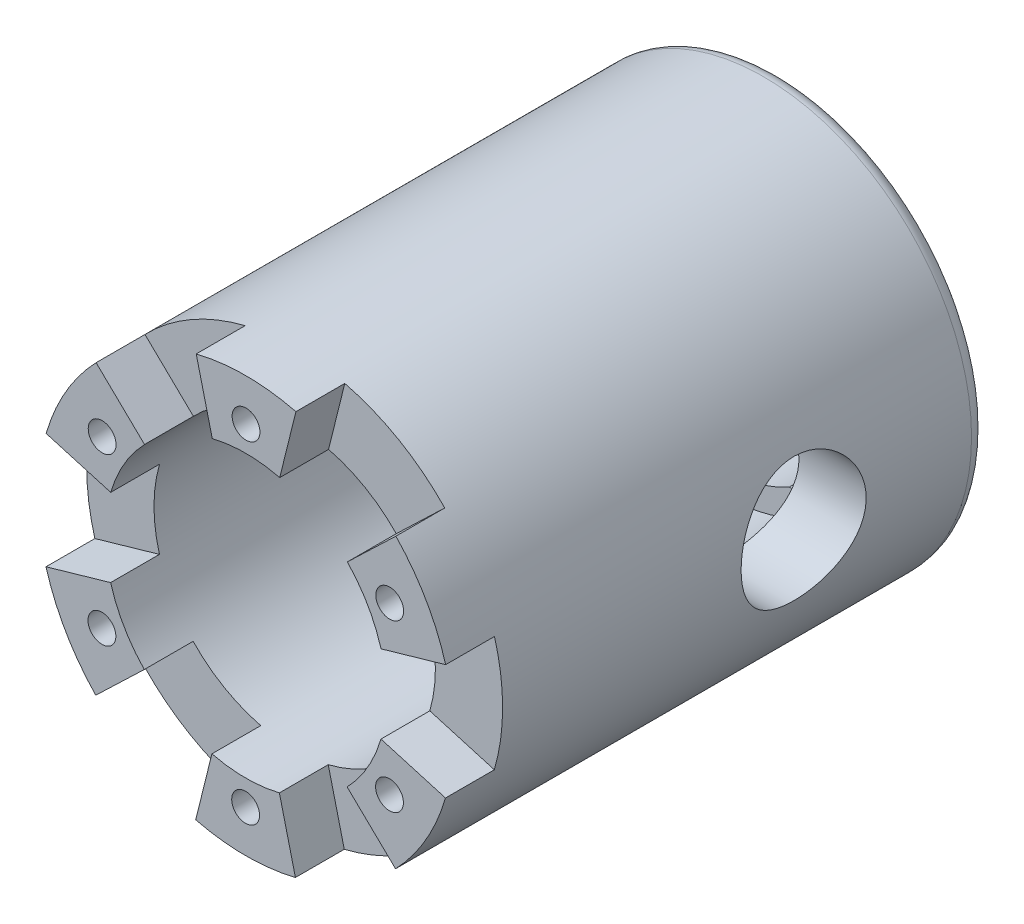
from build123d import *

# Parameters (mm, degrees)
SKETCH1_R                                      = 16.891
BOSS_EXTRUDE1_DEPTH                            = 43.3324
SKETCH9_R                                      = 9.525
CUT_EXTRUDE6_DEPTH                             = 50.480386536
SKETCH10_R                                     = 11.43
BOSS_EXTRUDE2_DEPTH                            = 19.05
CUT_EXTRUDE7_START                             = -39.36365
SKETCH11_R                                     = 9.525
CUT_EXTRUDE7_DEPTH                             = 39.36365
CUT_EXTRUDE8_START                             = -3.96875
CUT_EXTRUDE8_DEPTH                             = 3.96875
CSK_FOR_2_FLAT_HEAD_MACHINE_SCREW1_D           = 2.2606
CSK_FOR_2_FLAT_HEAD_MACHINE_SCREW1_CSINK_D     = 4.3688
CSK_FOR_2_FLAT_HEAD_MACHINE_SCREW1_CSINK_ANGLE = 82
CIRPATTERN1_COUNT                              = 6
F_1_2_0_4_DIAMETER_HOLE1_D                     = 10.16
F_1_2_0_4_DIAMETER_HOLE1_DEPTH                 = 12.7
F_1_2_0_4_DIAMETER_HOLE1_TIP                   = 3.052371945
FILLET1_R                                      = 1.27
SKETCH16_W                                     = 16.51
SKETCH16_H                                     = 16.51
CUT_EXTRUDE9_DEPTH                             = 12.7


with BuildPart() as part:
    # Sketch1 → Boss-Extrude1 (new body)
    with BuildSketch(Plane.XY):
        Circle(SKETCH1_R)
    extrude(amount=BOSS_EXTRUDE1_DEPTH)

    # Sketch9 → Cut-Extrude6 (cut, through all)
    with BuildSketch(Plane(origin=(0, 0, 0), x_dir=(-1, 0, 0), z_dir=(0, 0, -1))):
        Circle(SKETCH9_R)
        with BuildLine():
            ThreePointArc((-5.359640753, -7.874), (0, -9.525), (5.359640753, -7.874))
            Line((5.359640753, -7.874), (-5.359640753, -7.874))
        make_face()
        with BuildLine():
            ThreePointArc((-7.874, 5.359640753), (-9.525, 0), (-7.874, -5.359640753))
            Line((-7.874, -5.359640753), (-7.874, 5.359640753))
        make_face()
        with BuildLine():
            Line((-5.359640753, 7.874), (5.359640753, 7.874))
            ThreePointArc((5.359640753, 7.874), (0, 9.525), (-5.359640753, 7.874))
        make_face()
        with BuildLine():
            Line((7.874, 5.359640753), (7.874, -5.359640753))
            ThreePointArc((7.874, -5.359640753), (9.102897204, -2.804084075), (9.525, 0))
            ThreePointArc((9.525, 0), (9.102897204, 2.804084075), (7.874, 5.359640753))
        make_face()
    extrude(amount=-CUT_EXTRUDE6_DEPTH, mode=Mode.SUBTRACT)

    # Sketch10 → Boss-Extrude2 (add)
    # profile 1 of 2: a face of its own
    with BuildSketch(Plane(origin=(0, 0, 0), x_dir=(-1, 0, 0), z_dir=(0, 0, -1))):
        Circle(SKETCH10_R)
        with BuildLine():
            ThreePointArc((-5.359640753, -7.874), (-4.453933477, 8.419507206), (9.525, 0))
            ThreePointArc((9.525, 0), (8.419507206, -4.453933477), (5.359640753, -7.874))
            ThreePointArc((5.359640753, -7.874), (0, -9.525), (-5.359640753, -7.874))
        make_face(mode=Mode.SUBTRACT)
    # profile 2 of 2: a face of its own
    with BuildSketch(Plane(origin=(0, 0, 0), x_dir=(-1, 0, 0), z_dir=(0, 0, -1))):
        Circle(SKETCH10_R)
        with BuildLine():
            ThreePointArc((-5.359640753, -7.874), (-4.453933477, 8.419507206), (9.525, 0))
            ThreePointArc((9.525, 0), (8.419507206, -4.453933477), (5.359640753, -7.874))
            ThreePointArc((5.359640753, -7.874), (0, -9.525), (-5.359640753, -7.874))
        make_face(mode=Mode.SUBTRACT)
    extrude(amount=-BOSS_EXTRUDE2_DEPTH)

    # Sketch11 → Cut-Extrude7 (cut)
    with BuildSketch(Plane.XY.offset(43.3324).offset(CUT_EXTRUDE7_START)):
        with BuildLine():
            Line((-9.153468369, -2.634319991), (-10.984162043, -3.161183989))
            ThreePointArc((-10.984162043, -3.161183989), (1.596234295, -11.317991698), (11.43, 0))
            ThreePointArc((11.43, 0), (1.610471515, 11.315974615), (-10.976173491, 3.188810986))
            Line((-10.976173491, 3.188810986), (-9.146811242, 2.657342489))
            ThreePointArc((-9.146811242, 2.657342489), (1.342059596, 9.429978846), (9.525, 0))
            ThreePointArc((9.525, 0), (1.330195246, -9.431659748), (-9.153468369, -2.634319991))
        make_face()
        with Locations(Location((0, 0, 0), (0, 0, 180))):
            Circle(SKETCH11_R)
        with BuildLine():
            ThreePointArc((-10.984162043, -3.161183989), (-11.297244321, 0.014212394), (-10.976173491, 3.188810986))
            Line((-10.976173491, 3.188810986), (0, 0))
            Line((0, 0), (-10.984162043, -3.161183989))
        make_face()
        with BuildLine():
            ThreePointArc((-10.976173491, 3.188810986), (-11.429990955, 0.014379395), (-10.984162043, -3.161183989))
            ThreePointArc((-10.984162043, -3.161183989), (-11.297244321, 0.014212394), (-10.976173491, 3.188810986))
        make_face()
    extrude(amount=CUT_EXTRUDE7_DEPTH, mode=Mode.SUBTRACT)

    # Sketch11<4> → Cut-Extrude8 (cut)
    with BuildSketch(Plane.XY.offset(43.3324).offset(CUT_EXTRUDE8_START)):
        with BuildLine():
            ThreePointArc((-10.976173491, 3.188810986), (-11.297244321, 0.014212394), (-10.984162043, -3.161183989))
            Line((-10.984162043, -3.161183989), (0, 0))
            Line((0, 0), (-10.976173491, 3.188810986))
        make_face()
        with BuildLine():
            ThreePointArc((-10.976173491, 3.188810986), (-11.429990955, 0.014379395), (-10.984162043, -3.161183989))
            ThreePointArc((-10.984162043, -3.161183989), (-11.297244321, 0.014212394), (-10.976173491, 3.188810986))
        make_face()
        with BuildLine():
            Line((-16.232150575, -4.67152745), (-10.984162043, -3.161183989))
            ThreePointArc((-10.984162043, -3.161183989), (-11.429990955, 0.014379395), (-10.976173491, 3.188810986))
            Line((-10.976173491, 3.188810986), (-16.220345269, 4.712354013))
            ThreePointArc((-16.220345269, 4.712354013), (-16.925737574, 0.021293268), (-16.232150575, -4.67152745))
        make_face()
        with BuildLine():
            Line((0, 0), (-10.984162043, -3.161183989))
            ThreePointArc((-10.984162043, -3.161183989), (1.596234295, -11.317991698), (11.43, 0))
            ThreePointArc((11.43, 0), (1.610471515, 11.315974615), (-10.976173491, 3.188810986))
            Line((-10.976173491, 3.188810986), (0, 0))
        make_face()
    cut_extrude8 = extrude(amount=CUT_EXTRUDE8_DEPTH, mode=Mode.SUBTRACT)

    # CSK for #2 Flat Head Machine Screw1 (through all)
    with Locations(Plane(origin=(0, 0, 0), x_dir=(-1, 0, 0), z_dir=(0, 0, -1))):
        with Locations((11.671937945, 6.75838911)):
            csk_for_2_flat_head_machine_screw1 = CounterSinkHole(CSK_FOR_2_FLAT_HEAD_MACHINE_SCREW1_D / 2, CSK_FOR_2_FLAT_HEAD_MACHINE_SCREW1_CSINK_D / 2, counter_sink_angle=CSK_FOR_2_FLAT_HEAD_MACHINE_SCREW1_CSINK_ANGLE)

    # CirPattern1: Cut-Extrude8, CSK for #2 Flat Head Machine Screw1 ×6 about axis
    cirpattern1_axis = Axis((0, 0, 0), (0, 0, 1))
    add([cut_extrude8.rotate(cirpattern1_axis, i * 360 / CIRPATTERN1_COUNT) for i in range(1, CIRPATTERN1_COUNT)], mode=Mode.SUBTRACT)
    add([csk_for_2_flat_head_machine_screw1.rotate(cirpattern1_axis, i * 360 / CIRPATTERN1_COUNT) for i in range(1, CIRPATTERN1_COUNT)], mode=Mode.SUBTRACT)

    # 1/2 (0.4) Diameter Hole1
    with Locations(Plane(origin=(16.890986634, -0.02124955, 14.908061188), x_dir=(0.001258039772, 0.999999208668, 0), z_dir=(0.999999208668, -0.001258039772, 0))):
        with Locations((0, 0)):
            Hole(F_1_2_0_4_DIAMETER_HOLE1_D / 2, depth=F_1_2_0_4_DIAMETER_HOLE1_DEPTH)
            with Locations((0, 0, -(F_1_2_0_4_DIAMETER_HOLE1_DEPTH + F_1_2_0_4_DIAMETER_HOLE1_TIP / 2))):  # 118° drill point
                Cone(0, F_1_2_0_4_DIAMETER_HOLE1_D / 2, F_1_2_0_4_DIAMETER_HOLE1_TIP, mode=Mode.SUBTRACT)

    # Fillet1
    # the kernel refuses this fillet: 1.27 mm, written as the material it takes off along each edge
    with BuildSketch(Plane(origin=(0, 0, 0), x_dir=(1, 0, 0), z_dir=(0, -1, 0))) as fillet1_piece_1:
        with BuildLine():
            CenterArc((16.891 - FILLET1_R, FILLET1_R), FILLET1_R, 270, 90)
            Line((16.891 - FILLET1_R, 0), (16.891, 0))
            Line((16.891, 0), (16.891, FILLET1_R))
        make_face()
    revolve(axis=Axis((0, 0, 0), (0, 0, 1)), mode=Mode.SUBTRACT)

    # Sketch16 → Cut-Extrude9 (cut)
    with BuildSketch(Plane(origin=(0, 0, 0), x_dir=(-1, 0, 0), z_dir=(0, 0, -1))):
        with Locations((0.016967686, 0.019651839)):
            Rectangle(SKETCH16_W, SKETCH16_H)
    extrude(amount=-CUT_EXTRUDE9_DEPTH, mode=Mode.SUBTRACT)


solid = part.part
